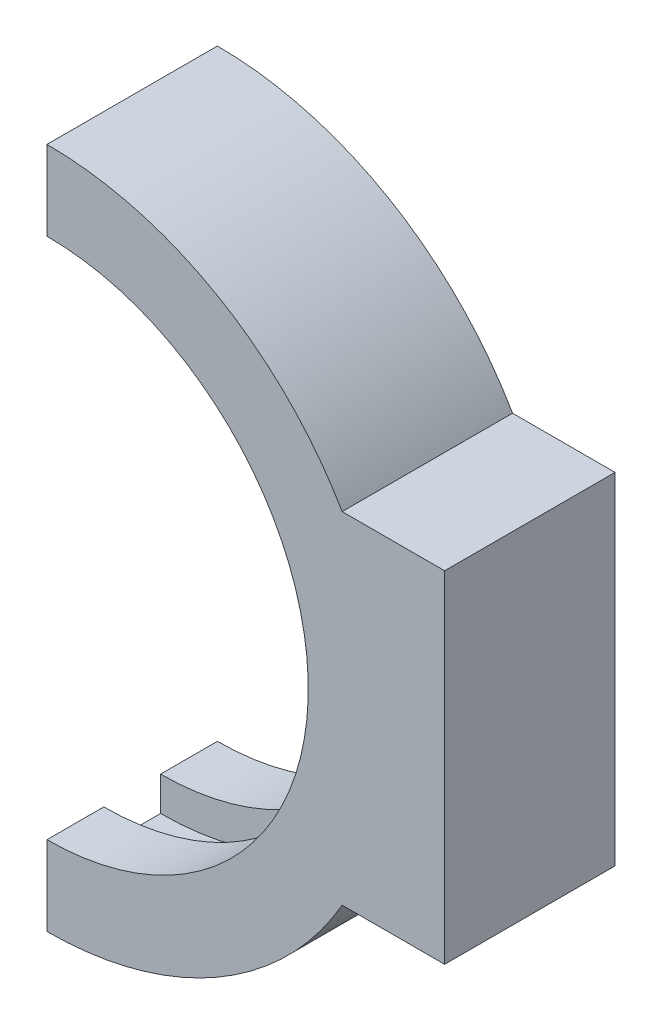
from build123d import *

# Parameters (mm, degrees)
BOSS_EXTRUDE1_DEPTH = 5
BOSS_EXTRUDE2_DEPTH = 5
BOSS_EXTRUDE4_START = 5
BOSS_EXTRUDE4_DEPTH = 5


with BuildPart() as part:
    # Sketch1 → Boss-Extrude1 (new body)
    with BuildSketch(Plane.XY):
        with BuildLine():
            Line((0, 26.485074627), (0, 30.485074627))
            ThreePointArc((0, 30.485074627), (15, 26.46583674), (25.980762114, 15.485074627))
            Line((25.980762114, 15.485074627), (35, 15.485074627))
            Line((35, 15.485074627), (35, -14.514925373))
            Line((35, -14.514925373), (25.980762114, -14.514925373))
            ThreePointArc((25.980762114, -14.514925373), (15, -25.495687487), (0, -29.514925373))
            Line((0, -29.514925373), (0, -25.514925373))
            ThreePointArc((0, -25.514925373), (26, 0.485074627), (0, 26.485074627))
        make_face()
    extrude(amount=BOSS_EXTRUDE1_DEPTH)

    # Sketch2 → Boss-Extrude2 (add)
    with BuildSketch(Plane.XY.offset(5)):
        with BuildLine():
            Line((0, 26.485074627), (0, 23.485074627))
            ThreePointArc((0, 23.485074627), (23, 0.485074627), (0, -22.514925373))
            Line((0, -22.514925373), (0, -25.514925373))
            Line((0, -25.514925373), (0, -29.514925373))
            ThreePointArc((0, -29.514925373), (15, -25.495687487), (25.980762114, -14.514925373))
            Line((25.980762114, -14.514925373), (35, -14.514925373))
            Line((35, -14.514925373), (35, 15.485074627))
            Line((35, 15.485074627), (25.980762114, 15.485074627))
            ThreePointArc((25.980762114, 15.485074627), (15, 26.46583674), (0, 30.485074627))
            Line((0, 30.485074627), (0, 26.485074627))
        make_face()
    extrude(amount=BOSS_EXTRUDE2_DEPTH)

    # Sketch3 → Boss-Extrude4 (add)
    with BuildSketch(Plane(origin=(0, 0, 0), x_dir=(-1, 0, 0), z_dir=(0, 0, -1)).offset(BOSS_EXTRUDE4_START)):
        with BuildLine():
            Line((0, -22.514925373), (0, -29.514925373))
            ThreePointArc((0, -29.514925373), (-15, -25.495687487), (-25.980762114, -14.514925373))
            Line((-25.980762114, -14.514925373), (-35, -14.514925373))
            Line((-35, -14.514925373), (-35, 15.485074627))
            Line((-35, 15.485074627), (-25.980762114, 15.485074627))
            ThreePointArc((-25.980762114, 15.485074627), (-15, 26.46583674), (0, 30.485074627))
            Line((0, 30.485074627), (0, 23.485074627))
            ThreePointArc((0, 23.485074627), (-23, 0.485074627), (0, -22.514925373))
        make_face()
    extrude(amount=-BOSS_EXTRUDE4_DEPTH)


solid = part.part
